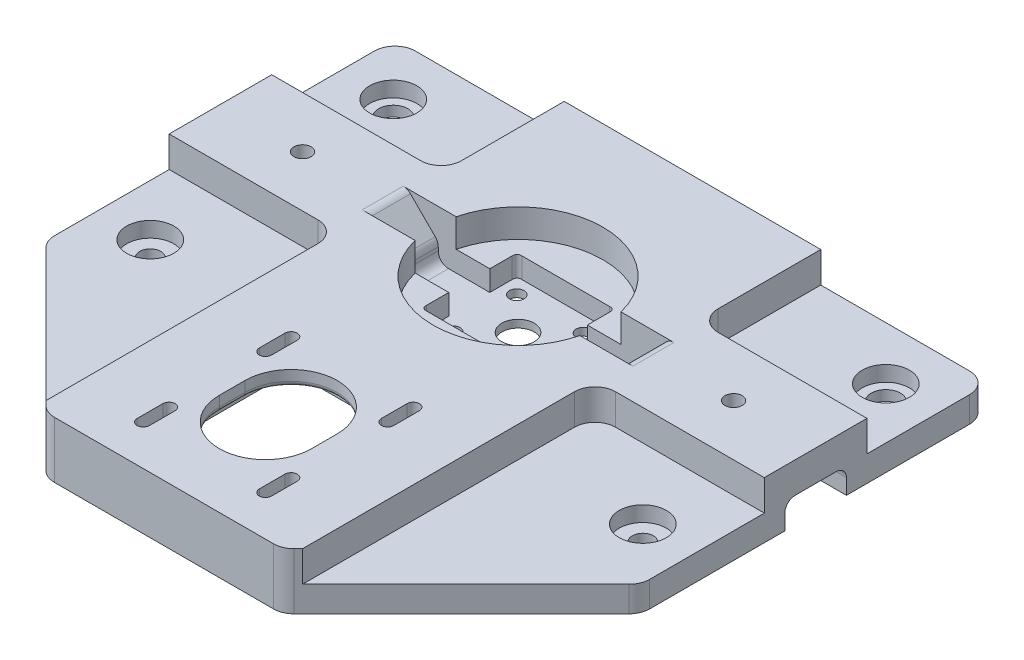
from build123d import *

# Parameters (mm, degrees)
SKETCH2_R                  = 2.6035
SKETCH2_R_2                = 3.6195
BOSS_EXTRUDE1_DEPTH        = 6.35
SKETCH3_R                  = 2.12725
CUT_EXTRUDE1_DEPTH         = 171.884623357
SKETCH4_R                  = 4.0005
CUT_EXTRUDE2_DEPTH         = 171.884623357
BOSS_EXTRUDE2_START        = 7.62
SKETCH5_R                  = 4.0005
BOSS_EXTRUDE2_DEPTH        = 7.62
FILLET3_R                  = 5.08
SKETCH6_R                  = 5.842
COUNTERSINKS_DEPTH         = 3.81
SKETCH8_R                  = 21.0185
SKETCH8_R_2                = 4.0005
BEARING_SPACE_DEPTH        = 6.985
SKETCH9_W                  = 24.13
SKETCH9_H                  = 23.622
SKETCH9_R                  = 4.0005
ROTARY_ENCODER_SPACE_DEPTH = 5.08
FILLET4_SIZE               = 1.27
SKETCH10_R                 = 1.7907
CUT_EXTRUDE7_DEPTH         = 172.19227852
SKETCH11_W                 = 43.18
SKETCH11_H                 = 49.784
CUT_EXTRUDE8_DEPTH         = 10.16
SKETCH11_2_R               = 11.43
CUT_EXTRUDE9_DEPTH         = 172.337073922
FILLET7_R                  = 1.27
CUT_EXTRUDE10_DEPTH        = 172.337073922
SKETCH3_2_R                = 2.12725
CUT_EXTRUDE11_DEPTH        = 171.936527401
SKETCH14_W                 = 43.18
SKETCH14_H                 = 15.24
CUT_EXTRUDE12_DEPTH        = 6.35
FILLET8_R                  = 2.54
SKETCH15_W                 = 49.657
SKETCH15_H                 = 10.16
CUT_EXTRUDE13_DEPTH        = 172.19227852
CHAMFER1_SIZE              = 7.62
FILLET9_R                  = 2.54


with BuildPart() as part:
    # Sketch2 → Boss-Extrude1 (new body)
    with BuildSketch(Plane(origin=(0, 0, 0), x_dir=(1, 0, 0), z_dir=(0, 1, 0))):
        Polygon((0, 33.02), (0, 0), (44.45, -44.45), (102.87, -44.45), (147.32, 0), (147.32, 86.36), (20.32, 86.36), (0, 86.36), (0, 53.34), align=None)
        with Locations(Location((12.7, 13.1064, 0), (0, 0, 270))):
            Circle(SKETCH2_R, mode=Mode.SUBTRACT)
        with Locations(Location((12.7, 73.2536, 0), (0, 0, 270))):
            Circle(SKETCH2_R_2, mode=Mode.SUBTRACT)
        with Locations(Location((134.62, 73.2536, 0), (0, 0, 270))):
            Circle(SKETCH2_R_2, mode=Mode.SUBTRACT)
        with Locations(Location((134.62, 13.1064, 0), (0, 0, 270))):
            Circle(SKETCH2_R, mode=Mode.SUBTRACT)
    extrude(amount=BOSS_EXTRUDE1_DEPTH)

    # Sketch3 → Cut-Extrude1 (cut, through all)
    with BuildSketch(Plane(origin=(0, 6.35, 0), x_dir=(1, 0, 0), z_dir=(0, 1, 0))):
        with Locations(Location((20.32, 43.18, 0), (0, 0, 270))):
            Circle(SKETCH3_R)
        with Locations(Location((127, 43.18, 0), (0, 0, 270))):
            Circle(SKETCH3_R)
    extrude(amount=-CUT_EXTRUDE1_DEPTH, mode=Mode.SUBTRACT)

    # Sketch4 → Cut-Extrude2 (cut, through all)
    with BuildSketch(Plane(origin=(0, 6.35, 0), x_dir=(1, 0, 0), z_dir=(0, 1, 0))):
        with Locations(Location((73.66, 43.18, 0), (0, 0, 270))):
            Circle(SKETCH4_R)
    extrude(amount=-CUT_EXTRUDE2_DEPTH, mode=Mode.SUBTRACT)

    # Sketch5 → Boss-Extrude2 (add)
    with BuildSketch(Plane(origin=(0, 6.35, 0), x_dir=(1, 0, 0), z_dir=(0, 1, 0)).offset(BOSS_EXTRUDE2_START)):
        Polygon((41.91, 86.36), (105.41, 86.36), (105.41, 55.88), (147.32, 55.88), (147.32, 30.48), (105.41, 30.48), (105.41, 0), (105.41, -41.91), (102.87, -44.45), (44.45, -44.45), (41.91, -41.91), (41.91, 0), (41.91, 30.48), (0, 30.48), (0, 55.88), (41.91, 55.88), align=None)
        with Locations(Location((73.66, 43.18, 0), (0, 0, 270))):
            Circle(SKETCH5_R, mode=Mode.SUBTRACT)
    extrude(amount=-BOSS_EXTRUDE2_DEPTH)

    # Fillet3
    fillet3_edges = [part.edges().sort_by_distance(p)[0] for p in [
        (44.45, 6.985, 44.45),
        (0, 3.175, 0),
        (0, 3.175, -86.36),
        (147.32, 3.175, -86.36),
        (147.32, 3.175, 0),
        (102.87, 6.985, 44.45),
        (105.41, 10.16, -55.88),
        (41.91, 10.16, -55.88),
        (41.91, 10.16, -30.48),
        (105.41, 10.16, -30.48),
    ]]
    fillet(fillet3_edges, radius=FILLET3_R)

    # Sketch6 → Countersinks (cut)
    with BuildSketch(Plane(origin=(0, 6.35, 0), x_dir=(1, 0, 0), z_dir=(0, 1, 0))):
        with Locations(Location((12.7, 73.2536, 0), (0, 0, 270))):
            Circle(SKETCH6_R)
        with Locations(Location((12.7, 13.1064, 0), (0, 0, 270))):
            Circle(SKETCH6_R)
        with Locations(Location((134.62, 73.2536, 0), (0, 0, 270))):
            Circle(SKETCH6_R)
        with Locations(Location((134.62, 13.1064, 0), (0, 0, 270))):
            Circle(SKETCH6_R)
    extrude(amount=-COUNTERSINKS_DEPTH, mode=Mode.SUBTRACT)

    # Sketch8 → Bearing Space (cut)
    with BuildSketch(Plane(origin=(0, 13.97, 0), x_dir=(1, 0, 0), z_dir=(0, 1, 0))):
        with Locations(Location((73.66, 43.18, 0), (0, 0, 270))):
            Circle(SKETCH8_R)
        with Locations(Location((73.66, 43.18, 0), (0, 0, 270))):
            Circle(SKETCH8_R_2, mode=Mode.SUBTRACT)
    extrude(amount=-BEARING_SPACE_DEPTH, mode=Mode.SUBTRACT)

    # Sketch9 → Rotary Encoder Space (cut)
    with BuildSketch(Plane(origin=(0, 6.985, 0), x_dir=(1, 0, 0), z_dir=(0, 1, 0))):
        with Locations((73.66, 43.18)):
            Rectangle(SKETCH9_W, SKETCH9_H)
        with Locations(Location((73.66, 43.18, 0), (0, 0, 270))):
            Circle(SKETCH9_R, mode=Mode.SUBTRACT)
    extrude(amount=-ROTARY_ENCODER_SPACE_DEPTH, mode=Mode.SUBTRACT)

    # Fillet4
    # a fillet whose section is not a circle: 1.27 mm, written as the material it adds along each edge
    with BuildSketch(Plane(origin=(61.595, 6.985, -31.369), x_dir=(1, 0, 0), z_dir=(0, -1, 0)), Plane(origin=(85.725, 6.985, -31.369), x_dir=(0, 0, -1), z_dir=(0, -1, 0)), Plane(origin=(85.725, 6.985, -54.991), x_dir=(-1, 0, 0), z_dir=(0, -1, 0))) as fillet4_piece_1:
        with BuildLine():
            add(Edge.make_bspline([(FILLET4_SIZE, 0), (FILLET4_SIZE * 0.831801948466, 0), (FILLET4_SIZE * 0.663603896932, 0), (FILLET4_SIZE * 0.292893218813, -FILLET4_SIZE * 0.0716919198361), (FILLET4_SIZE * 0.0716919198361, -FILLET4_SIZE * 0.292893218813), (0, -FILLET4_SIZE * 0.663603896932), (0, -FILLET4_SIZE * 0.831801948466), (0, -FILLET4_SIZE)], knots=[0, 0, 0, 0, 0, 0, 0.5, 0.5, 1, 1, 1, 1, 1, 1], degree=5))
            Line((0, -FILLET4_SIZE), (-FILLET4_SIZE * 0.02, -FILLET4_SIZE))
            Line((-FILLET4_SIZE * 0.02, -FILLET4_SIZE), (-FILLET4_SIZE * 0.02, FILLET4_SIZE * 0.02))
            Line((-FILLET4_SIZE * 0.02, FILLET4_SIZE * 0.02), (FILLET4_SIZE, FILLET4_SIZE * 0.02))
            Line((FILLET4_SIZE, FILLET4_SIZE * 0.02), (FILLET4_SIZE, 0))
        make_face()
    extrude(amount=5.08)
    with BuildSketch(Plane(origin=(61.595, 6.985, -54.991), x_dir=(1, 0, 0), z_dir=(0, -1, 0))) as fillet4_piece_2:
        with BuildLine():
            add(Edge.make_bspline([(FILLET4_SIZE, 0), (FILLET4_SIZE * 0.831801948466, 0), (FILLET4_SIZE * 0.663603896932, 0), (FILLET4_SIZE * 0.292893218813, FILLET4_SIZE * 0.0716919198361), (FILLET4_SIZE * 0.0716919198361, FILLET4_SIZE * 0.292893218813), (0, FILLET4_SIZE * 0.663603896932), (0, FILLET4_SIZE * 0.831801948466), (0, FILLET4_SIZE)], knots=[0, 0, 0, 0, 0, 0, 0.5, 0.5, 1, 1, 1, 1, 1, 1], degree=5))
            Line((0, FILLET4_SIZE), (-FILLET4_SIZE * 0.02, FILLET4_SIZE))
            Line((-FILLET4_SIZE * 0.02, FILLET4_SIZE), (-FILLET4_SIZE * 0.02, -FILLET4_SIZE * 0.02))
            Line((-FILLET4_SIZE * 0.02, -FILLET4_SIZE * 0.02), (FILLET4_SIZE, -FILLET4_SIZE * 0.02))
            Line((FILLET4_SIZE, -FILLET4_SIZE * 0.02), (FILLET4_SIZE, 0))
        make_face()
    extrude(amount=5.08)

    # Sketch10 → Cut-Extrude7 (cut, through all)
    with BuildSketch(Plane(origin=(0, 1.905, 0), x_dir=(1, 0, 0), z_dir=(0, 1, 0))):
        with Locations(Location((81.9023, 51.1048, 0), (0, 0, 270))):
            Circle(SKETCH10_R)
        with Locations(Location((81.9023, 35.2552, 0), (0, 0, 270))):
            Circle(SKETCH10_R)
        with Locations(Location((65.4177, 35.2552, 0), (0, 0, 270))):
            Circle(SKETCH10_R)
        with Locations(Location((65.4177, 51.1048, 0), (0, 0, 270))):
            Circle(SKETCH10_R)
    extrude(amount=-CUT_EXTRUDE7_DEPTH, mode=Mode.SUBTRACT)

    # Sketch11 → Cut-Extrude8 (cut)
    with BuildSketch(Plane.XZ):
        with Locations((73.66, 16.1671)):
            Rectangle(SKETCH11_W, SKETCH11_H)
        with BuildLine():
            Line((85.09, 19.3421), (85.09, 12.9921))
            ThreePointArc((85.09, 12.9921), (73.66, 1.5621), (62.23, 12.9921))
            Line((62.23, 12.9921), (62.23, 19.3421))
            ThreePointArc((62.23, 19.3421), (73.66, 30.7721), (85.09, 19.3421))
        make_face(mode=Mode.SUBTRACT)
    extrude(amount=-CUT_EXTRUDE8_DEPTH, mode=Mode.SUBTRACT)

    # Sketch11<2> → Cut-Extrude9 (cut, through all)
    with BuildSketch(Plane.XZ):
        with Locations((73.66, 16.1671)):
            Circle(SKETCH11_2_R)
        with BuildLine():
            ThreePointArc((62.23, 12.9921), (73.66, 1.5621), (85.09, 12.9921))
            Line((85.09, 12.9921), (85.09, 19.3421))
            ThreePointArc((85.09, 19.3421), (73.66, 30.7721), (62.23, 19.3421))
            Line((62.23, 19.3421), (62.23, 12.9921))
        make_face()
    extrude(amount=-CUT_EXTRUDE9_DEPTH, mode=Mode.SUBTRACT)

    # Fillet7
    fillet7_edges = [part.edges().sort_by_distance(p)[0] for p in [
        (95.25, 10.16, 16.1671),
        (95.25, 5.08, 41.0591),
        (95.25, 5.08, -8.7249),
        (52.07, 10.16, 16.1671),
        (52.07, 5.08, -8.7249),
        (52.07, 5.08, 41.0591),
        (73.66, 10.16, 30.7721),
        (62.23, 10.16, 16.1671),
        (73.66, 10.16, 1.5621),
        (85.09, 10.16, 16.1671),
    ]]
    fillet(fillet7_edges, radius=FILLET7_R)

    # Sketch13 → Cut-Extrude10 (cut, through all)
    with BuildSketch(Plane(origin=(0, 13.97, 0), x_dir=(1, 0, 0), z_dir=(0, 1, 0))):
        with BuildLine():
            Line((87.249, -4.2291), (87.249, 2.1209))
            ThreePointArc((87.249, 2.1209), (88.773, 3.6449), (90.297, 2.1209))
            Line((90.297, 2.1209), (90.297, -4.2291))
            ThreePointArc((90.297, -4.2291), (88.773, -5.7531), (87.249, -4.2291))
        make_face()
        with BuildLine():
            Line((57.023, -4.2291), (57.023, 2.1209))
            ThreePointArc((57.023, 2.1209), (58.547, 3.6449), (60.071, 2.1209))
            Line((60.071, 2.1209), (60.071, -4.2291))
            ThreePointArc((60.071, -4.2291), (58.547, -5.7531), (57.023, -4.2291))
        make_face()
        with BuildLine():
            Line((57.023, -34.4551), (57.023, -28.1051))
            ThreePointArc((57.023, -28.1051), (58.547, -26.5811), (60.071, -28.1051))
            Line((60.071, -28.1051), (60.071, -34.4551))
            ThreePointArc((60.071, -34.4551), (58.547, -35.9791), (57.023, -34.4551))
        make_face()
        with BuildLine():
            Line((87.249, -34.4551), (87.249, -28.1051))
            ThreePointArc((87.249, -28.1051), (88.773, -26.5811), (90.297, -28.1051))
            Line((90.297, -28.1051), (90.297, -34.4551))
            ThreePointArc((90.297, -34.4551), (88.773, -35.9791), (87.249, -34.4551))
        make_face()
    extrude(amount=-CUT_EXTRUDE10_DEPTH, mode=Mode.SUBTRACT)

    # Sketch3<2> → Cut-Extrude11 (cut, through all)
    with BuildSketch(Plane(origin=(0, 6.35, 0), x_dir=(1, 0, 0), z_dir=(0, 1, 0))):
        with Locations(Location((20.32, 43.18, 0), (0, 0, 270))):
            Circle(SKETCH3_2_R)
        with Locations(Location((127, 43.18, 0), (0, 0, 270))):
            Circle(SKETCH3_2_R)
    extrude(amount=CUT_EXTRUDE11_DEPTH, mode=Mode.SUBTRACT)

    # Sketch14 → Cut-Extrude12 (cut)
    with BuildSketch(Plane.XZ):
        with Locations((21.59, -43.18)):
            Rectangle(SKETCH14_W, SKETCH14_H)
        with Locations((125.73, -43.18)):
            Rectangle(SKETCH14_W, SKETCH14_H)
    extrude(amount=-CUT_EXTRUDE12_DEPTH, mode=Mode.SUBTRACT)

    # Fillet8
    fillet8_edges = [part.edges().sort_by_distance(p)[0] for p in [
        (21.59, 6.35, -50.8),
        (43.18, 3.175, -50.8),
        (21.59, 6.35, -35.56),
        (43.18, 6.35, -43.18),
        (43.18, 3.175, -35.56),
        (125.73, 6.35, -50.8),
        (104.14, 6.35, -43.18),
        (104.14, 3.175, -50.8),
        (125.73, 6.35, -35.56),
        (104.14, 3.175, -35.56),
    ]]
    fillet(fillet8_edges, radius=FILLET8_R)

    # Sketch15 → Cut-Extrude13 (cut, through all)
    with BuildSketch(Plane(origin=(0, 1.905, 0), x_dir=(1, 0, 0), z_dir=(0, 1, 0))):
        with Locations((73.66, 43.18)):
            Rectangle(SKETCH15_W, SKETCH15_H)
    extrude(amount=CUT_EXTRUDE13_DEPTH, mode=Mode.SUBTRACT)

    # Chamfer1
    chamfer1_edges = [part.edges().sort_by_distance(p)[0] for p in [
        (48.8315, 13.97, -43.18),
        (98.4885, 13.97, -43.18),
    ]]
    chamfer(chamfer1_edges, length=CHAMFER1_SIZE)

    # Fillet9
    fillet9_edges = [part.edges().sort_by_distance(p)[0] for p in [
        (48.8315, 1.905, -43.18),
        (98.4885, 1.905, -43.18),
        (98.4885, 6.35, -43.18),
        (41.2115, 13.97, -43.18),
        (106.1085, 13.97, -43.18),
        (48.8315, 6.35, -43.18),
    ]]
    fillet(fillet9_edges, radius=FILLET9_R)


solid = part.part
